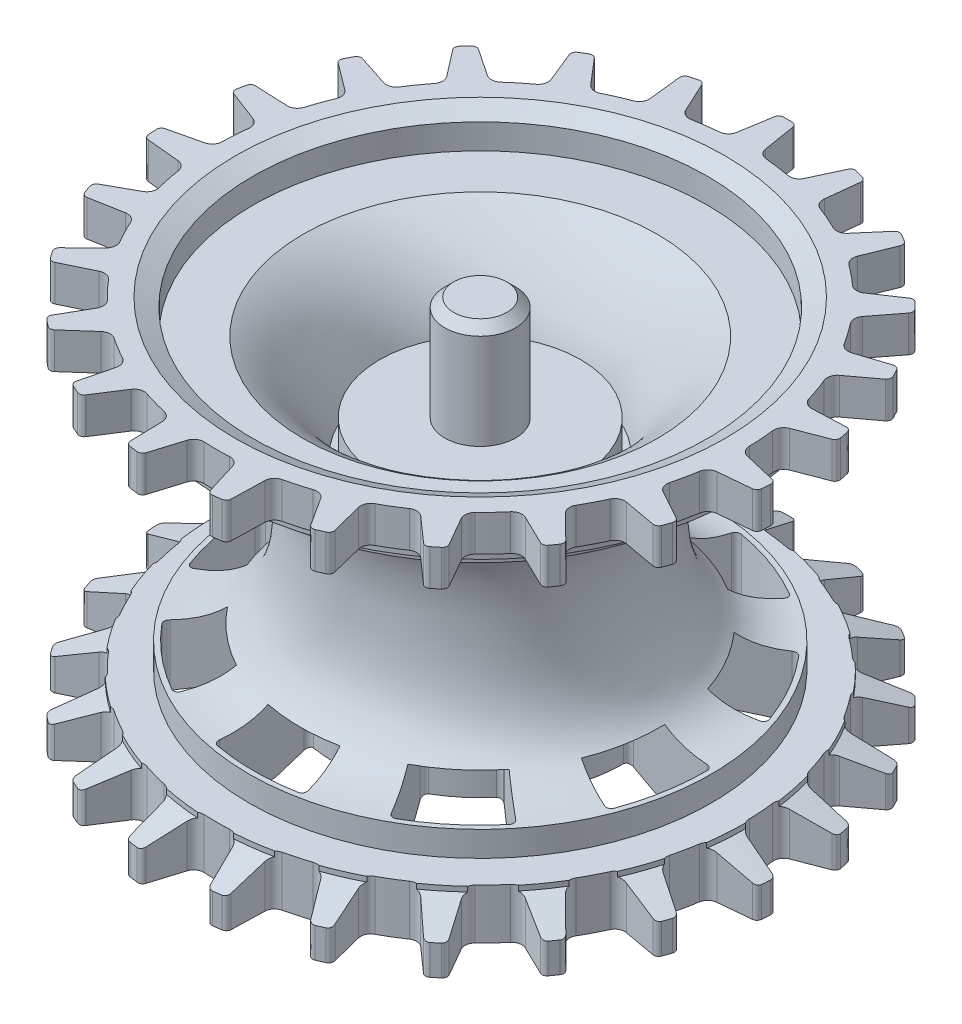
from build123d import *

# Parameters (mm, degrees)
CUT_EXTRUDE1_DEPTH       = 3.6
FILLET1_R                = 0.2
CIRPATTERN1_COUNT        = 9
FILLET1_OF_CIRPATTERN1_R = 0.2
CUT_EXTRUDE2_DEPTH       = 16
FILLET2_R                = 0.2
CIRPATTERN2_COUNT        = 23
FILLET2_OF_CIRPATTERN2_R = 0.2
SKETCH6_R                = 0.4
BOSS_EXTRUDE2_DEPTH      = 1
CHAMFER1_SIZE            = 0.2
SKETCH7_R                = 0.4
BOSS_EXTRUDE3_DEPTH      = 0.5
CIRPATTERN3_COUNT        = 23


with BuildPart() as part:
    # Sketch2 → Revolve1 (revolve)
    with BuildSketch(Plane.XY, mode=Mode.PRIVATE) as revolve1_sk:
        with BuildLine():
            Line((0, 1.05), (0, 14.85))
            Line((0, 14.85), (1.056446609, 14.85))
            Line((1.056446609, 14.85), (1.41, 14.496446609))
            Line((1.41, 14.496446609), (1.41, 10.696446609))
            Line((1.41, 10.696446609), (4, 10.696446609))
            Line((4, 10.696446609), (4, 9.423466992))
            Line((4, 9.423466992), (4.25, 9.423466992))
            ThreePointArc((4.25, 9.423466992), (5.21112512, 11.761664587), (7.05, 13.496446609))
            Line((7.05, 13.496446609), (9.05, 13.496446609))
            Line((9.05, 13.496446609), (9.05, 14.496446609))
            Line((9.05, 14.496446609), (9.75, 14.85))
            Line((9.75, 14.85), (12.25, 14.85))
            Line((12.25, 14.85), (12.25, 13.41))
            Line((12.25, 13.41), (10.33, 13.41))
            Line((10.33, 13.41), (10.33, 13.11))
            Line((10.33, 13.11), (9.33, 13.11))
            Line((9.33, 13.11), (9.33, 12.286034154))
            add(Edge.make_bspline(
                [(9.33, 12.286034154), (6.33, 12.286034154), (5.74971443, 9.069928346), (5.868517714, 5.980891783), (6.2, 3), (9.2, 3)],
                knots=[0, 0, 0, 0, 0.33944983, 0.43944983, 1, 1, 1, 1], degree=3))
            Line((9.2, 3), (9.2, 2))
            Line((9.2, 2), (10.563414997, 2))
            Line((10.563414997, 2), (10.563414997, 1.8))
            Line((10.563414997, 1.8), (12.25, 1.2))
            Line((12.25, 1.2), (12.25, 0))
            Line((12.25, 0), (10.3, 0))
            Line((10.3, 0), (10.3, 0.5))
            Line((10.3, 0.5), (9.2, 0.5))
            Line((9.2, 0.5), (6.9, 0.989637029))
            Line((6.9, 0.989637029), (5.15, 2))
            Line((5.15, 2), (2, 2))
            Line((2, 2), (2, 1.8))
            Line((2, 1.8), (0.4, 1.8))
            Line((0.4, 1.8), (0.4, 1.05))
            Line((0.4, 1.05), (0, 1.05))
        make_face()
    revolve(revolve1_sk.sketch.rotate(Axis((0, 1.05, 0), (0, 1, 0)), 90), axis=Axis((0, 1.05, 0), (0, 1, 0)))

    # Sketch3 → Cut-Extrude1 (cut)
    with BuildSketch(Plane.XZ):
        with BuildLine():
            Line((-1.8, 8.818163074), (-1.15, 5.633826408))
            ThreePointArc((-1.15, 5.633826408), (0, 5.75), (1.15, 5.633826408))
            Line((1.15, 5.633826408), (1.8, 8.818163074))
            ThreePointArc((1.8, 8.818163074), (0, 9), (-1.8, 8.818163074))
        make_face()
    cut_extrude1 = extrude(amount=-CUT_EXTRUDE1_DEPTH, mode=Mode.SUBTRACT)

    # Fillet1
    fillet1_edges = [part.edges().sort_by_distance(p)[0] for p in [
        (-1.15, 2.626794919, 5.633826408),
        (-1.8, 1.773222546, 8.818163074),
        (1.8, 1.773222546, 8.818163074),
        (1.15, 2.626794919, 5.633826408),
    ]]
    fillet(fillet1_edges, radius=FILLET1_R)

    # CirPattern1: Cut-Extrude1 ×9 about axis
    cirpattern1_axis = Axis((0, 0, 0), (0, 1, 0))
    for i in range(1, CIRPATTERN1_COUNT):
        add(cut_extrude1.rotate(cirpattern1_axis, i * 360 / CIRPATTERN1_COUNT), mode=Mode.SUBTRACT)

    # Fillet1 of CirPattern1
    fillet1_of_cirpattern1_edges = [part.edges().sort_by_distance(p)[0] for p in [
        (2.740402701, 2.626794919, 5.054967165),
        (4.289325967, 1.773222546, 7.912122519),
        (7.047085962, 1.773222546, 5.598087124),
        (4.50230492, 2.626794919, 3.576555663),
        (5.348540522, 2.626794919, 2.110832605),
        (8.371628643, 1.773222546, 3.303911904),
        (8.996762082, 1.773222546, -0.241396007),
        (5.74793133, 2.626794919, -0.154225227),
        (5.45403679, 2.626794919, -1.82098399),
        (8.536753237, 1.773222546, -2.85023581),
        (6.736753237, 1.773222546, -5.967927264),
        (4.30403679, 2.626794919, -3.812842419),
        (3.00752863, 2.626794919, -4.900741938),
        (4.707436116, 1.773222546, -7.670726512),
        (1.324542681, 1.773222546, -8.901999028),
        (0.846235602, 2.626794919, -5.687388268),
        (-0.846235602, 2.626794919, -5.687388268),
        (-1.324542681, 1.773222546, -8.901999028),
        (-4.707436116, 1.773222546, -7.670726512),
        (-3.00752863, 2.626794919, -4.900741938),
        (-4.30403679, 2.626794919, -3.812842419),
        (-6.736753237, 1.773222546, -5.967927264),
        (-8.536753237, 1.773222546, -2.85023581),
        (-5.45403679, 2.626794919, -1.82098399),
        (-5.74793133, 2.626794919, -0.154225227),
        (-8.996762082, 1.773222546, -0.241396007),
        (-8.371628643, 1.773222546, 3.303911904),
        (-5.348540522, 2.626794919, 2.110832605),
        (-4.50230492, 2.626794919, 3.576555663),
        (-7.047085962, 1.773222546, 5.598087124),
        (-4.289325967, 1.773222546, 7.912122519),
        (-2.740402701, 2.626794919, 5.054967165),
    ]]
    fillet(fillet1_of_cirpattern1_edges, radius=FILLET1_OF_CIRPATTERN1_R)

    # Sketch4 → Cut-Extrude2 (cut)
    with BuildSketch(Plane.XZ):
        with BuildLine():
            Line((0, 12.25), (0, 10.5))
            ThreePointArc((0, 10.5), (0.250070932, 10.497021698), (0.5, 10.488088482))
            ThreePointArc((0.5, 10.488088482), (0.748882953, 10.56025768), (0.901305284, 10.769825213))
            Line((0.901305284, 10.769825213), (1.335, 12.177038844))
            ThreePointArc((1.335, 12.177038844), (0.668496135, 12.231746111), (0, 12.25))
        make_face()
        with BuildLine():
            ThreePointArc((-0.5, 10.488088482), (-0.250070932, 10.497021698), (0, 10.5))
            Line((0, 10.5), (0, 12.25))
            ThreePointArc((0, 12.25), (-0.668496135, 12.231746111), (-1.335, 12.177038844))
            Line((-1.335, 12.177038844), (-0.901305284, 10.769825213))
            ThreePointArc((-0.901305284, 10.769825213), (-0.748882953, 10.56025768), (-0.5, 10.488088482))
        make_face()
    cut_extrude2 = extrude(amount=-CUT_EXTRUDE2_DEPTH, mode=Mode.SUBTRACT)

    # Fillet2
    fillet2_edges = [part.edges().sort_by_distance(p)[0] for p in [
        (1.335, 0.6, 12.177038844),
        (-1.335, 0.6, 12.177038844),
        (1.335, 14.13, 12.177038844),
        (-1.335, 14.13, 12.177038844),
    ]]
    fillet(fillet2_edges, radius=FILLET2_R)

    # CirPattern2: Cut-Extrude2 ×23 about axis
    cirpattern2_axis = Axis((0, 0, 0), (0, 1, 0))
    for i in range(1, CIRPATTERN2_COUNT):
        add(cut_extrude2.rotate(cirpattern2_axis, i * 360 / CIRPATTERN2_COUNT), mode=Mode.SUBTRACT)

    # Fillet2 of CirPattern2
    fillet2_of_cirpattern2_edges = [part.edges().sort_by_distance(p)[0] for p in [
        (4.570820341, 0.6, 11.365302522),
        (1.999831184, 0.6, 12.085659901),
        (4.570820341, 14.13, 11.365302522),
        (1.999831184, 14.13, 12.085659901),
        (7.467643847, 0.6, 9.710653705),
        (5.186344037, 0.6, 11.097942851),
        (7.467643847, 14.13, 9.710653705),
        (5.186344037, 14.13, 11.097942851),
        (9.810626372, 0.6, 7.335810126),
        (7.988209479, 0.6, 9.28714215),
        (9.810626372, 14.13, 7.335810126),
        (7.988209479, 14.13, 9.28714215),
        (11.425999619, 0.6, 4.416903068),
        (10.197625968, 0.6, 6.787556602),
        (11.425999619, 14.13, 4.416903068),
        (10.197625968, 14.13, 6.787556602),
        (12.193958744, 0.6, 1.170414517),
        (11.650731189, 0.6, 3.784569031),
        (12.193958744, 14.13, 1.170414517),
        (11.650731189, 14.13, 3.784569031),
        (12.057547734, 0.6, -2.162878325),
        (12.239754977, 0.6, 0.500897289),
        (12.057547734, 14.13, -2.162878325),
        (12.239754977, 14.13, 0.500897289),
        (11.026883567, 0.6, -5.335760376),
        (11.921012132, 0.6, -2.819923714),
        (11.026883567, 14.13, -5.335760376),
        (11.921012132, 14.13, -2.819923714),
        (9.178405891, 0.6, -8.11291349),
        (10.718142351, 0.6, -5.931603876),
        (9.178405891, 14.13, -8.11291349),
        (10.718142351, 14.13, -5.931603876),
        (6.649207839, 0.6, -10.288368924),
        (8.720356985, 0.6, -8.603364113),
        (6.649207839, 14.13, -10.288368924),
        (8.720356985, 14.13, -8.603364113),
        (3.626868459, 0.6, -11.700783101),
        (6.075822634, 0.6, -10.637052191),
        (3.626868459, 14.13, -11.700783101),
        (6.075822634, 14.13, -10.637052191),
        (0.335540837, 0.6, -12.245403723),
        (2.980672313, 0.6, -11.88183877),
        (0.335540837, 14.13, -12.245403723),
        (2.980672313, 14.13, -11.88183877),
        (-2.980672313, 0.6, -11.88183877),
        (-0.335540837, 0.6, -12.245403723),
        (-2.980672313, 14.13, -11.88183877),
        (-0.335540837, 14.13, -12.245403723),
        (-6.075822634, 0.6, -10.637052191),
        (-3.626868459, 0.6, -11.700783101),
        (-6.075822634, 14.13, -10.637052191),
        (-3.626868459, 14.13, -11.700783101),
        (-8.720356985, 0.6, -8.603364113),
        (-6.649207839, 0.6, -10.288368924),
        (-8.720356985, 14.13, -8.603364113),
        (-6.649207839, 14.13, -10.288368924),
        (-10.718142351, 0.6, -5.931603876),
        (-9.178405891, 0.6, -8.11291349),
        (-10.718142351, 14.13, -5.931603876),
        (-9.178405891, 14.13, -8.11291349),
        (-11.921012132, 0.6, -2.819923714),
        (-11.026883567, 0.6, -5.335760376),
        (-11.921012132, 14.13, -2.819923714),
        (-11.026883567, 14.13, -5.335760376),
        (-12.239754977, 0.6, 0.500897289),
        (-12.057547734, 0.6, -2.162878325),
        (-12.239754977, 14.13, 0.500897289),
        (-12.057547734, 14.13, -2.162878325),
        (-11.650731189, 0.6, 3.784569031),
        (-12.193958744, 0.6, 1.170414517),
        (-11.650731189, 14.13, 3.784569031),
        (-12.193958744, 14.13, 1.170414517),
        (-10.197625968, 0.6, 6.787556602),
        (-11.425999619, 0.6, 4.416903068),
        (-10.197625968, 14.13, 6.787556602),
        (-11.425999619, 14.13, 4.416903068),
        (-7.988209479, 0.6, 9.28714215),
        (-9.810626372, 0.6, 7.335810126),
        (-7.988209479, 14.13, 9.28714215),
        (-9.810626372, 14.13, 7.335810126),
        (-5.186344037, 0.6, 11.097942851),
        (-7.467643847, 0.6, 9.710653705),
        (-5.186344037, 14.13, 11.097942851),
        (-7.467643847, 14.13, 9.710653705),
        (-1.999831184, 0.6, 12.085659901),
        (-4.570820341, 0.6, 11.365302522),
        (-1.999831184, 14.13, 12.085659901),
        (-4.570820341, 14.13, 11.365302522),
    ]]
    fillet(fillet2_of_cirpattern2_edges, radius=FILLET2_OF_CIRPATTERN2_R)

    # Sketch6 → Boss-Extrude2 (add)
    with BuildSketch(Plane.XZ.offset(-2)):
        with Locations(Location((0, 3, 0), (0, 0, 270))):
            Circle(SKETCH6_R)
        with Locations(Location((2.853169549, 0.927050983, 0), (0, 0, 270))):
            Circle(SKETCH6_R)
        with Locations(Location((1.763355757, -2.427050983, 0), (0, 0, 270))):
            Circle(SKETCH6_R)
        with Locations(Location((-1.763355757, -2.427050983, 0), (0, 0, 270))):
            Circle(SKETCH6_R)
        with Locations(Location((-2.853169549, 0.927050983, 0), (0, 0, 270))):
            Circle(SKETCH6_R)
    extrude(amount=BOSS_EXTRUDE2_DEPTH)

    # Chamfer1
    chamfer1_edges = [part.edges().sort_by_distance(p)[0] for p in [
        (0, 1, 3.4),
        (2.853169549, 1, 1.327050983),
        (1.763355757, 1, -2.027050983),
        (-1.763355757, 1, -2.027050983),
        (-2.853169549, 1, 1.327050983),
    ]]
    chamfer(chamfer1_edges, length=CHAMFER1_SIZE)

    # Sketch7 → Boss-Extrude3 (add)
    with BuildSketch(Plane.XZ.offset(-0.5)):
        with Locations(Location((0, 9.65, 0), (0, 0, 270))):
            Circle(SKETCH7_R)
    boss_extrude3 = extrude(amount=BOSS_EXTRUDE3_DEPTH)

    # CirPattern3: Boss-Extrude3 ×23 about axis
    cirpattern3_axis = Axis((0, 0, 0), (0, 1, 0))
    for i in range(1, CIRPATTERN3_COUNT):
        add(boss_extrude3.rotate(cirpattern3_axis, i * 360 / CIRPATTERN3_COUNT))


solid = part.part
